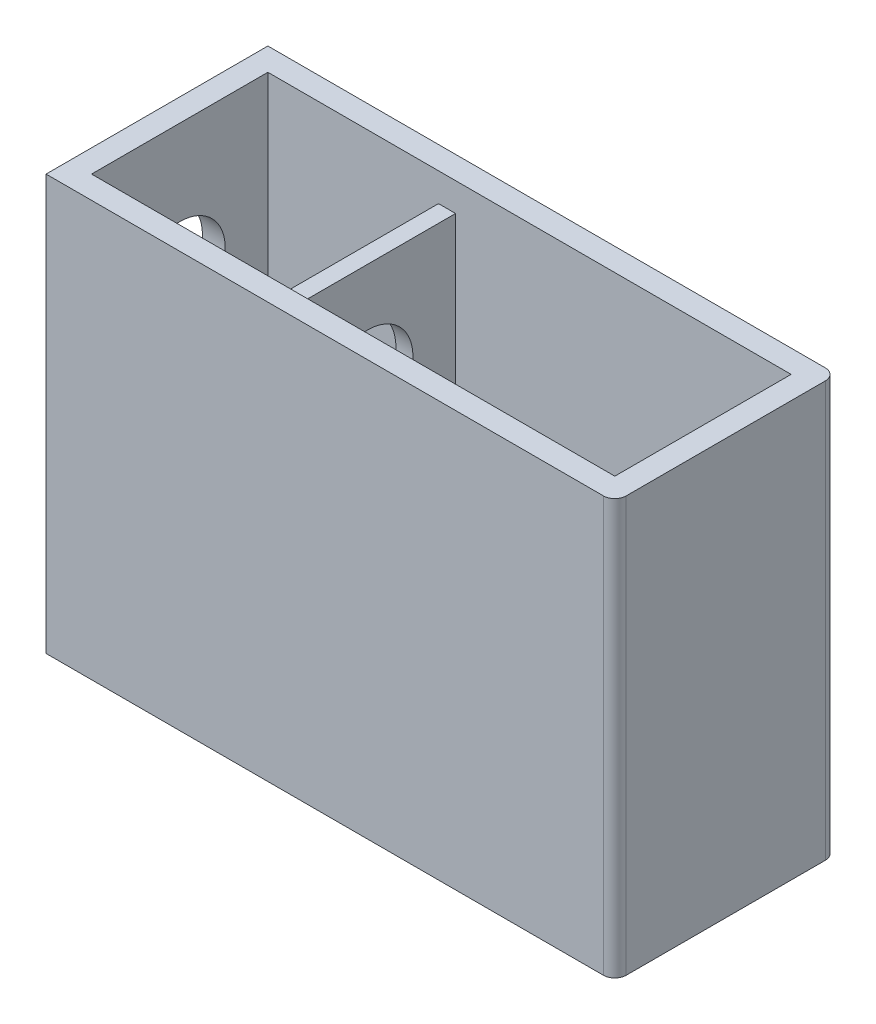
from build123d import *

# Parameters (mm, degrees)
SKETCH1_W               = 92
SKETCH1_H               = 31
BOSS_EXTRUDE2_DEPTH     = 3
SKETCH1_3_W             = 100
SKETCH1_3_H             = 39
SKETCH1_3_W_2           = 92
SKETCH1_3_H_2           = 31
BOSS_EXTRUDE3_DEPTH     = 73
FILLET1_R               = 2
FILLET2_R               = 2
SKETCH3_W               = 7.14
SKETCH3_H               = 31
BOSS_EXTRUDE4_DEPTH     = 28
SKETCH4_W               = 7.14
SKETCH4_H               = 2.85103565
BOSS_EXTRUDE5_DEPTH     = 4
SKETCH5_W               = 7.14
SKETCH5_H               = 5.56896435
CUT_EXTRUDE1_DEPTH      = 28
SKETCH4_3_R             = 0.5
CUT_EXTRUDE3_DEPTH      = 20
LPATTERN5_COUNT         = 2
LPATTERN5_PITCH         = 47.64
LPATTERN6_COUNT         = 2
LPATTERN6_PITCH         = 49
SKETCH10_W              = 2.85103565
SKETCH10_H              = 32
BOSS_EXTRUDE6_DEPTH     = 41
CUT_EXTRUDE4_DEPTH      = 36
CUT_EXTRUDE4_DEPTH_BACK = 35
SKETCH12_R              = 8
SKETCH13_W              = 3
SKETCH13_H              = 31
BOSS_EXTRUDE7_DEPTH     = 65
CUT_EXTRUDE5_START      = -5
SKETCH14_R              = 8
CUT_EXTRUDE5_DEPTH      = 5


with BuildPart() as part:
    # Sketch1 → Boss-Extrude2 (new body)
    with BuildSketch(Plane(origin=(0, 0, 0), x_dir=(1, 0, 0), z_dir=(0, 1, 0))):
        Rectangle(SKETCH1_W, SKETCH1_H)
    extrude(amount=BOSS_EXTRUDE2_DEPTH)

    # Sketch1<3> → Boss-Extrude3 (add)
    with BuildSketch(Plane(origin=(0, 0, 0), x_dir=(1, 0, 0), z_dir=(0, 1, 0))):
        Rectangle(SKETCH1_3_W, SKETCH1_3_H)
        Rectangle(SKETCH1_3_W_2, SKETCH1_3_H_2, mode=Mode.SUBTRACT)
    extrude(amount=BOSS_EXTRUDE3_DEPTH)

    # Fillet1
    fillet1_edges = [part.edges().sort_by_distance(p)[0] for p in [
        (50, 36.5, 19.5),
    ]]
    fillet(fillet1_edges, radius=FILLET1_R)

    # Fillet2
    fillet2_edges = [part.edges().sort_by_distance(p)[0] for p in [
        (50, 36.5, -19.5),
    ]]
    fillet(fillet2_edges, radius=FILLET2_R)

    # Sketch3 → Boss-Extrude4 (add)
    with BuildSketch(Plane(origin=(0, 3, 0), x_dir=(1, 0, 0), z_dir=(0, 1, 0))):
        with Locations((42.43, 0)):
            Rectangle(SKETCH3_W, SKETCH3_H)
    boss_extrude4 = extrude(amount=BOSS_EXTRUDE4_DEPTH)

    # Sketch4 → Boss-Extrude5 (add)
    with BuildSketch(Plane(origin=(0, 31, 0), x_dir=(1, 0, 0), z_dir=(0, 1, 0))):
        with Locations((42.43, -8.505517825)):
            Rectangle(SKETCH4_W, SKETCH4_H)
    boss_extrude5 = extrude(amount=BOSS_EXTRUDE5_DEPTH)

    # Sketch5 → Cut-Extrude1 (cut)
    with BuildSketch(Plane(origin=(0, 31, 0), x_dir=(1, 0, 0), z_dir=(0, 1, 0))):
        with Locations((42.43, -12.715517825)):
            Rectangle(SKETCH5_W, SKETCH5_H)
    cut_extrude1 = extrude(amount=-CUT_EXTRUDE1_DEPTH, mode=Mode.SUBTRACT)

    # Sketch4<3> → Cut-Extrude3 (cut)
    with BuildSketch(Plane(origin=(0, 31, 0), x_dir=(1, 0, 0), z_dir=(0, 1, 0))):
        with Locations((43.36, 8.92)):
            Circle(SKETCH4_3_R)
        with Locations((43.36, -1.08)):
            Circle(SKETCH4_3_R)
    cut_extrude3 = extrude(amount=-CUT_EXTRUDE3_DEPTH, mode=Mode.SUBTRACT)

    # LPattern5: Boss-Extrude4, Boss-Extrude5, Cut-Extrude1 ×2
    with Locations(*[(-i * LPATTERN5_PITCH, 0, 0) for i in range(1, LPATTERN5_COUNT)]):
        add(boss_extrude4)
        add(boss_extrude5)
        add(cut_extrude1, mode=Mode.SUBTRACT)

    # LPattern6: Cut-Extrude3 ×2
    with Locations(*[(-i * LPATTERN6_PITCH, 0, 0) for i in range(1, LPATTERN6_COUNT)]):
        add(cut_extrude3, mode=Mode.SUBTRACT)

    # Sketch10 → Boss-Extrude6 (add)
    with BuildSketch(Plane.ZY.offset(-38.86)):
        with Locations((8.505517825, 19)):
            Rectangle(SKETCH10_W, SKETCH10_H)
    extrude(amount=BOSS_EXTRUDE6_DEPTH)

    # Sketch12 → Cut-Extrude4 (cut, two sides: drawn at the far end of the back side and taken through both)
    with BuildSketch(Plane(origin=(-46, 0, 0), x_dir=(0, 0, -1), z_dir=(1, 0, 0)).offset(-CUT_EXTRUDE4_DEPTH_BACK)):
        with Locations((0, 50)):
            Circle(SKETCH12_R)
    extrude(amount=CUT_EXTRUDE4_DEPTH + CUT_EXTRUDE4_DEPTH_BACK, mode=Mode.SUBTRACT)

    # Sketch13 → Boss-Extrude7 (add)
    with BuildSketch(Plane(origin=(0, 3, 0), x_dir=(1, 0, 0), z_dir=(0, 1, 0))):
        with Locations((-14.5, 0)):
            Rectangle(SKETCH13_W, SKETCH13_H)
    extrude(amount=BOSS_EXTRUDE7_DEPTH)

    # Sketch14 → Cut-Extrude5 (cut)
    with BuildSketch(Plane.ZY.offset(16).offset(CUT_EXTRUDE5_START)):
        with Locations((0, 50)):
            Circle(SKETCH14_R)
    extrude(amount=CUT_EXTRUDE5_DEPTH, mode=Mode.SUBTRACT)


solid = part.part
